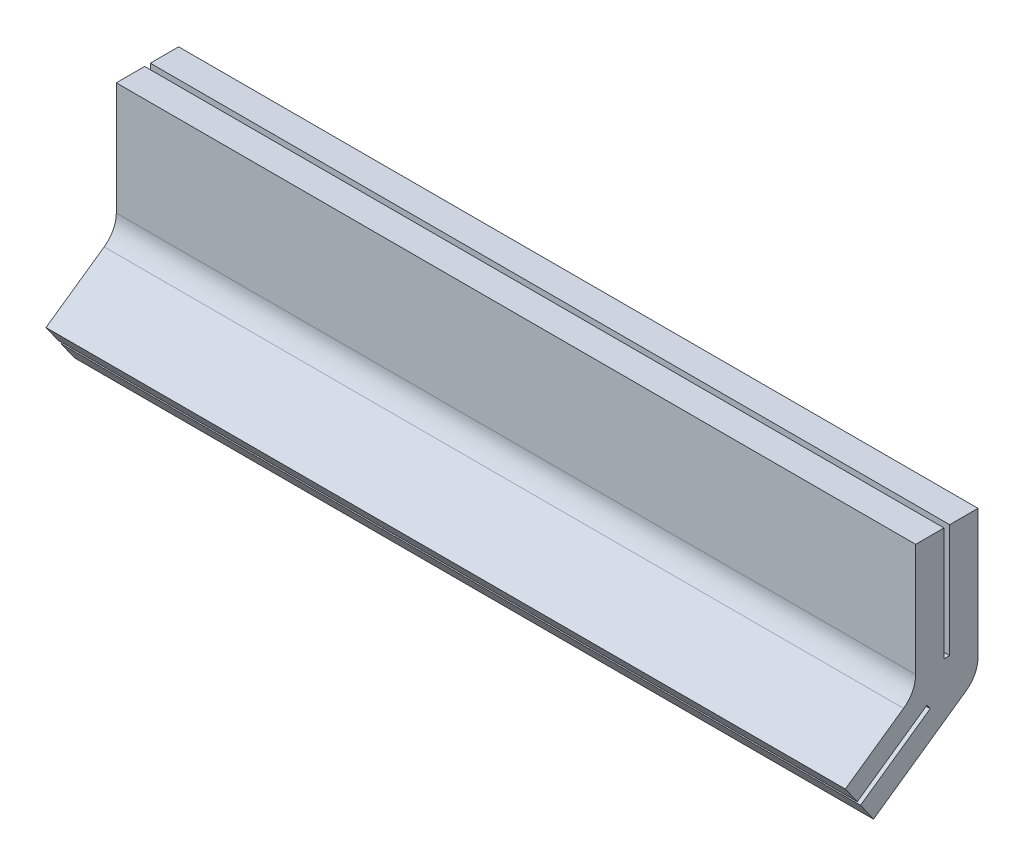
from build123d import *

# Parameters (mm, degrees)
BOSS_EXTRUDE2_DEPTH      = 141
BOSS_EXTRUDE2_DEPTH_BACK = 141
CAVITY1_START            = -323.284735655
CAVITY1_OUTLINE_W        = 282
CAVITY1_OUTLINE_H        = 40
CAVITY1_DEPTH            = 2


# Read off the part's stored shape, not the designer's step: Cavity1
with BuildPart() as part:
    # Sketch1 → Boss-Extrude2 (new, two sides: drawn at the far end of the back side and taken through both)
    with BuildSketch(Plane(origin=(0, 0, -321.284735655), x_dir=(0, 0, -1), z_dir=(1, 0, 0)).offset(-BOSS_EXTRUDE2_DEPTH_BACK)):
        with BuildLine():
            Line((-10, -285), (12, -285))
            Line((12, -285), (12, -330.531793911))
            ThreePointArc((12, -330.531793911), (10.917125793, -335.057815078), (7.903026481, -338.603613927))
            Line((7.903026481, -338.603613927), (-24.863055291, -361.546671381))
            Line((-24.863055291, -361.546671381), (-29.450107081, -354.994945144))
            Line((-29.450107081, -354.994945144), (-4.875892155, -337.787894608))
            Line((-4.875892155, -337.787894608), (-6.023045028, -336.149590519))
            Line((-6.023045028, -336.149590519), (-30.597606357, -353.35688361))
            Line((-30.597606357, -353.35688361), (-34.795346904, -347.361888815))
            Line((-34.795346904, -347.361888815), (-14.264235636, -332.985849937))
            ThreePointArc((-14.264235636, -332.985849937), (-11.129891668, -329.411815627), (-10, -324.794329494))
            Line((-10, -324.794329494), (-10, -285))
        make_face()
    extrude(amount=BOSS_EXTRUDE2_DEPTH + BOSS_EXTRUDE2_DEPTH_BACK)

    # Cavity1 outline → Cavity1 (cut)
    with BuildSketch(Plane.XY.offset(CAVITY1_START)):
        with Locations((0, -305)):
            Rectangle(CAVITY1_OUTLINE_W, CAVITY1_OUTLINE_H)
    extrude(amount=CAVITY1_DEPTH, mode=Mode.SUBTRACT)


solid = part.part
